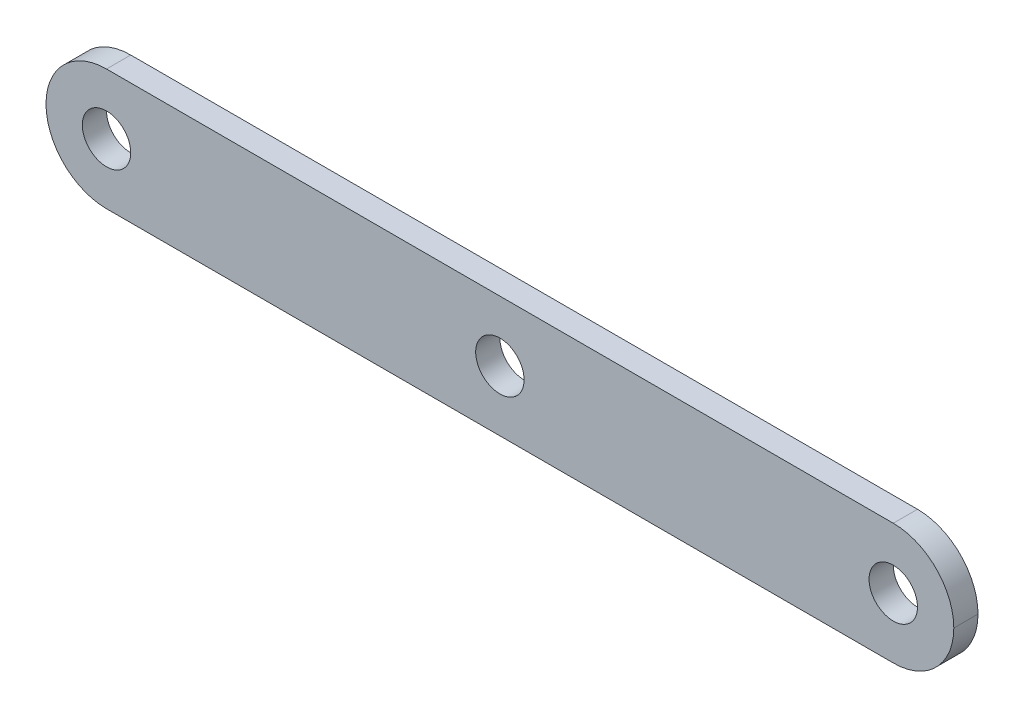
from build123d import *

# Parameters (mm, degrees)
SKETCH_1_W          = 75
SKETCH_1_H          = 10
EXTRUDE_1_DEPTH     = 2
FILLET_1_R          = 5
SKETCH_3_R          = 2
CUT_EXTRUDE_1_DEPTH = 2


with BuildPart() as part:
    # 草图1 → 凸台-拉伸1 (new body)
    with BuildSketch(Plane.XY):
        Rectangle(SKETCH_1_W, SKETCH_1_H)
    extrude(amount=EXTRUDE_1_DEPTH)

    # 圆角1
    fillet_1_edges = [part.edges().sort_by_distance(p)[0] for p in [
        (37.5, -5, 1),
        (-37.5, -5, 1),
        (-37.5, 5, 1),
        (37.5, 5, 1),
    ]]
    fillet(fillet_1_edges, radius=FILLET_1_R - 0.0001)  # a hair under: the kernel refuses the full size

    # 草图3 → 切除-拉伸1 (cut)
    with BuildSketch(Plane.XY.offset(2)):
        with Locations((-32.5, 0)):
            Circle(SKETCH_3_R)
        with Locations(Location((32.5, 0, 0), (0, 0, 180))):
            Circle(SKETCH_3_R)
        Circle(SKETCH_3_R)
    extrude(amount=-CUT_EXTRUDE_1_DEPTH, mode=Mode.SUBTRACT)


solid = part.part
